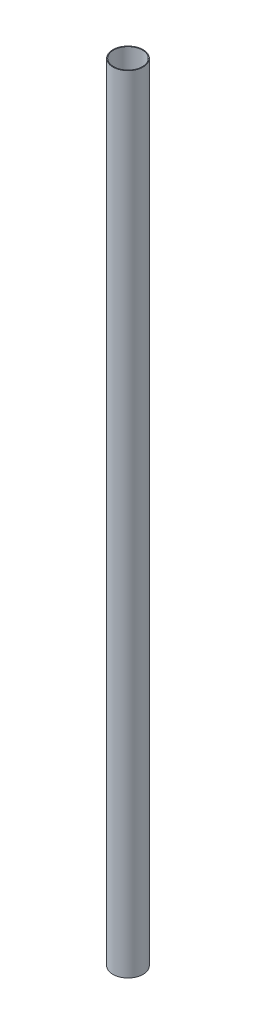
from build123d import *

# Parameters (mm, degrees)
SKETCH1_R   = 25.4
SKETCH1_R_2 = 24.1554
BODY_DEPTH  = 1320.8


with BuildPart() as part:
    # Sketch1 → body (new body)
    with BuildSketch(Plane(origin=(0, 0, 0), x_dir=(1, 0, 0), z_dir=(0, 1, 0))):
        Circle(SKETCH1_R)
        Circle(SKETCH1_R_2, mode=Mode.SUBTRACT)
    extrude(amount=BODY_DEPTH)


solid = part.part
